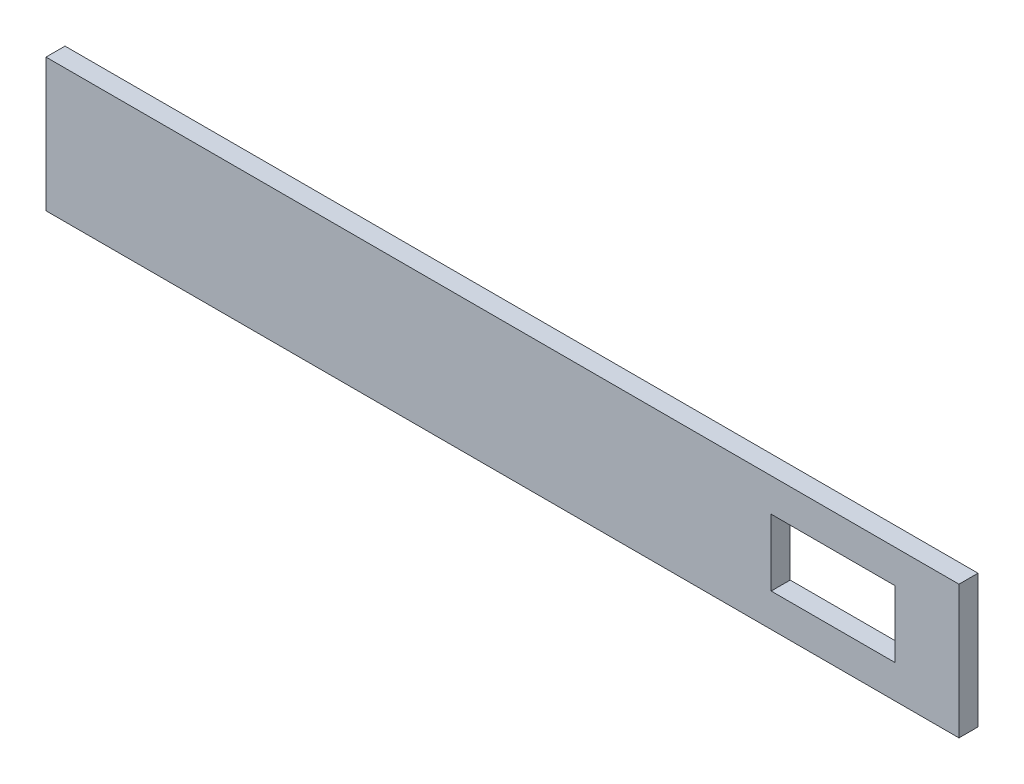
from build123d import *

# Parameters (mm, degrees)
SKETCH1_W           = 304.8
SKETCH1_H           = 44.45
BOSS_EXTRUDE1_DEPTH = 6.35
SKETCH2_W           = 41.275
SKETCH2_H           = 22.225
CUT_EXTRUDE1_DEPTH  = 264.747800776


with BuildPart() as part:
    # Sketch1 → Boss-Extrude1 (new body)
    with BuildSketch(Plane.XY):
        with Locations((-110.333, 0)):
            Rectangle(SKETCH1_W, SKETCH1_H)
    extrude(amount=BOSS_EXTRUDE1_DEPTH)

    # Sketch2 → Cut-Extrude1 (cut, through all)
    with BuildSketch(Plane.XY.offset(6.35)):
        Rectangle(SKETCH2_W, SKETCH2_H)
    extrude(amount=-CUT_EXTRUDE1_DEPTH, mode=Mode.SUBTRACT)


solid = part.part
